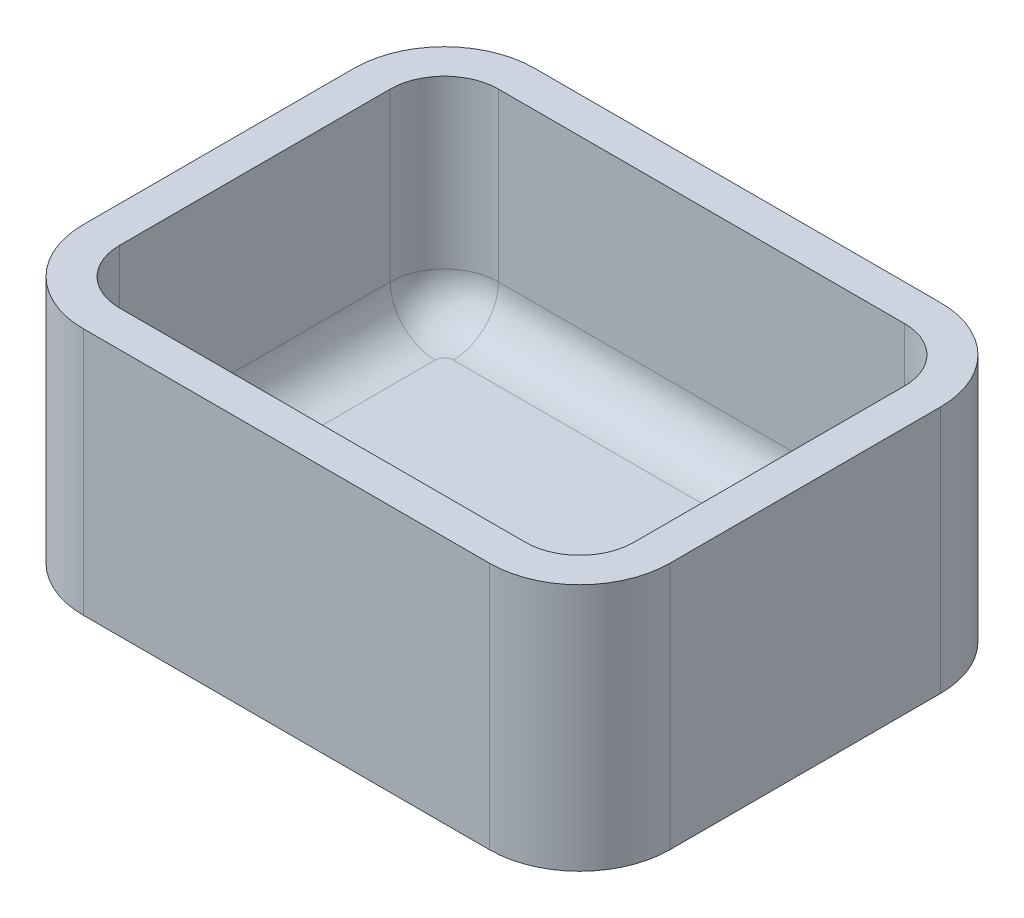
from build123d import *

# Parameters (mm, degrees)
ESQUISSE4_W             = 130
ESQUISSE4_H             = 100
BOSS_EXTRU_4_DEPTH      = 55
CONG_5_R                = 20
ENL_V_MAT_EXTRU_1_DEPTH = 47
CONG_6_SIZE             = 10


with BuildPart() as part:
    # Esquisse4 → Boss.-Extru.4 (new body)
    with BuildSketch(Plane(origin=(0, 0, 0), x_dir=(1, 0, 0), z_dir=(0, 1, 0))):
        with Locations((12.771948074, 16.229726537)):
            Rectangle(ESQUISSE4_W, ESQUISSE4_H)
    extrude(amount=BOSS_EXTRU_4_DEPTH)

    # Congé5
    cong_5_edges = [part.edges().sort_by_distance(p)[0] for p in [
        (-52.228051926, 27.5, -66.229726537),
        (77.771948074, 27.5, -66.229726537),
        (77.771948074, 27.5, 33.770273463),
        (-52.228051926, 27.5, 33.770273463),
    ]]
    fillet(cong_5_edges, radius=CONG_5_R)

    # Esquisse5 → Enlèv. mat.-Extru.1 (cut)
    with BuildSketch(Plane(origin=(0, 55, 0), x_dir=(1, 0, 0), z_dir=(0, 1, 0))):
        with BuildLine():
            Line((57.771948074, 58.229726537), (-32.228051926, 58.229726537))
            ThreePointArc((-32.228051926, 58.229726537), (-40.713333301, 54.715007912), (-44.228051926, 46.229726537))
            Line((-44.228051926, 46.229726537), (-44.228051926, -13.770273463))
            ThreePointArc((-44.228051926, -13.770273463), (-40.713333301, -22.255554837), (-32.228051926, -25.770273463))
            Line((-32.228051926, -25.770273463), (57.771948074, -25.770273463))
            ThreePointArc((57.771948074, -25.770273463), (66.257229448, -22.255554837), (69.771948074, -13.770273463))
            Line((69.771948074, -13.770273463), (69.771948074, 46.229726537))
            ThreePointArc((69.771948074, 46.229726537), (66.257229448, 54.715007912), (57.771948074, 58.229726537))
        make_face()
    extrude(amount=-ENL_V_MAT_EXTRU_1_DEPTH, mode=Mode.SUBTRACT)

    # Congé6
    # a fillet whose section is not a circle: 10 mm, written as the material it adds along each edge
    with BuildSketch(Plane(origin=(57.771948074, 8, -46.229726537), x_dir=(1, 0, 0), z_dir=(0, 0, 1))) as cong_6_piece_1:
        with BuildLine():
            Bezier((12, CONG_6_SIZE), (12, 0), (12 - CONG_6_SIZE, 0), weights=[1, 0.707106781, 1])
            Line((12 - CONG_6_SIZE, 0), (12, 0))
            Line((12, 0), (12, CONG_6_SIZE))
        make_face()
    revolve(axis=Axis((57.771948074, 8, -46.229726537), (0, 1, 0)), revolution_arc=90)
    with BuildSketch(Plane(origin=(69.771948074, 8, 13.770273463), x_dir=(0, 1, 0), z_dir=(0, 0, -1)), Plane(origin=(-44.228051926, 8, -46.229726537), x_dir=(0, 1, 0), z_dir=(0, 0, 1))) as cong_6_piece_2:
        with BuildLine():
            Bezier((CONG_6_SIZE, 0), (0, 0), (0, -CONG_6_SIZE), weights=[1, 0.707106781, 1])
            Line((0, -CONG_6_SIZE), (0, 0))
            Line((0, 0), (CONG_6_SIZE, 0))
        make_face()
    extrude(amount=60)
    with BuildSketch(Plane(origin=(57.771948074, 8, 13.770273463), x_dir=(0, 0, 1), z_dir=(-1, 0, 0))) as cong_6_piece_3:
        with BuildLine():
            Bezier((12, CONG_6_SIZE), (12, 0), (12 - CONG_6_SIZE, 0), weights=[1, 0.707106781, 1])
            Line((12 - CONG_6_SIZE, 0), (12, 0))
            Line((12, 0), (12, CONG_6_SIZE))
        make_face()
    revolve(axis=Axis((57.771948074, 8, 13.770273463), (0, 1, 0)), revolution_arc=90)
    with BuildSketch(Plane(origin=(-32.228051926, 8, 25.770273463), x_dir=(0, 1, 0), z_dir=(1, 0, 0)), Plane(origin=(57.771948074, 8, -58.229726537), x_dir=(0, 1, 0), z_dir=(-1, 0, 0))) as cong_6_piece_4:
        with BuildLine():
            Bezier((CONG_6_SIZE, 0), (0, 0), (0, -CONG_6_SIZE), weights=[1, 0.707106781, 1])
            Line((0, -CONG_6_SIZE), (0, 0))
            Line((0, 0), (CONG_6_SIZE, 0))
        make_face()
    extrude(amount=90)
    with BuildSketch(Plane(origin=(-32.228051926, 8, 13.770273463), x_dir=(-1, 0, 0), z_dir=(0, 0, -1))) as cong_6_piece_5:
        with BuildLine():
            Bezier((12, CONG_6_SIZE), (12, 0), (12 - CONG_6_SIZE, 0), weights=[1, 0.707106781, 1])
            Line((12 - CONG_6_SIZE, 0), (12, 0))
            Line((12, 0), (12, CONG_6_SIZE))
        make_face()
    revolve(axis=Axis((-32.228051926, 8, 13.770273463), (0, 1, 0)), revolution_arc=90)
    with BuildSketch(Plane(origin=(-32.228051926, 8, -46.229726537), x_dir=(0, 0, -1), z_dir=(1, 0, 0))) as cong_6_piece_6:
        with BuildLine():
            Bezier((12, CONG_6_SIZE), (12, 0), (12 - CONG_6_SIZE, 0), weights=[1, 0.707106781, 1])
            Line((12 - CONG_6_SIZE, 0), (12, 0))
            Line((12, 0), (12, CONG_6_SIZE))
        make_face()
    revolve(axis=Axis((-32.228051926, 8, -46.229726537), (0, 1, 0)), revolution_arc=90)


solid = part.part
